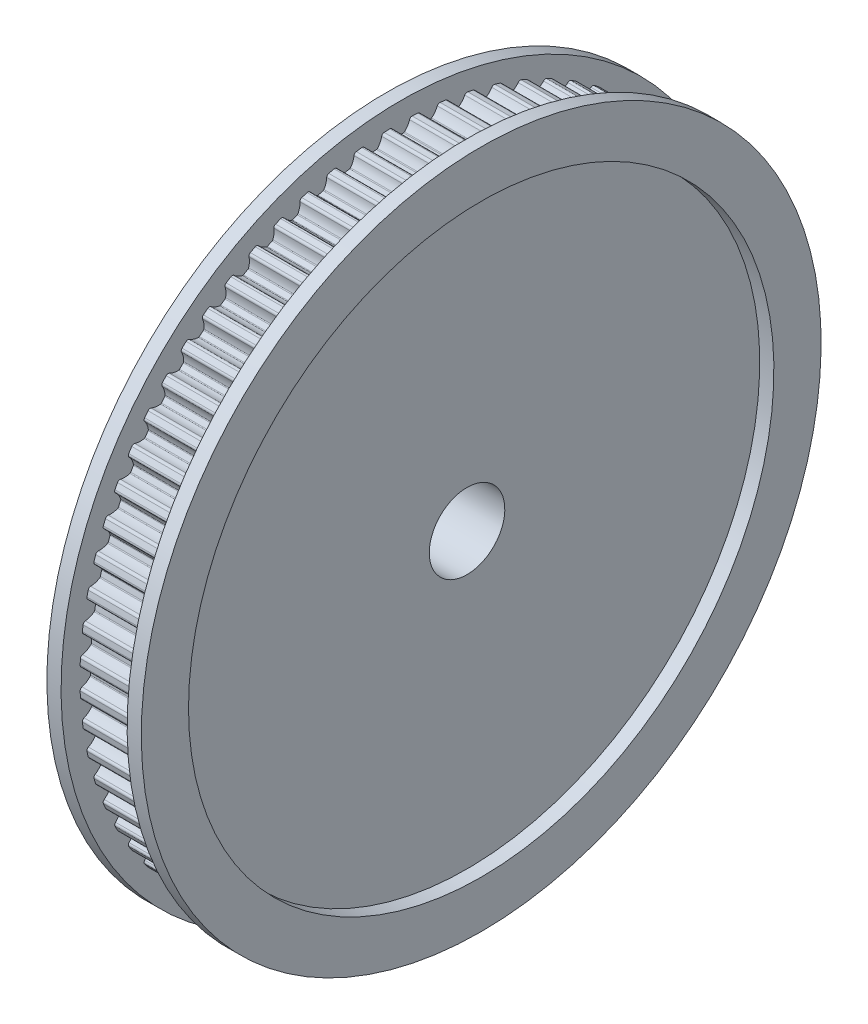
from build123d import *

# Parameters (mm, degrees)
HOLE_WIZARD_1_D          = 8
SKETCH_4_R               = 38.995
CUT_EXTRUDE_1_DEPTH      = 7
CUT_EXTRUDE_2_DEPTH      = 54.469617541
CUT_EXTRUDE_2_DEPTH_BACK = 54.469617541
SKETCH_6_W               = 17.213021686
SKETCH_6_H               = 104.733980807
SKETCH_6_W_2             = 36.314797365
SKETCH_6_H_2             = 107.365487863
SKETCH_9_R               = 36
SKETCH_9_R_2             = 31
EXTRUDE_1_DEPTH          = 1.5
MOVE_FACE_1_BY           = 2
MOVE_FACE_1_2_BY         = 2
MOVE_FACE_1_3_BY         = 2


with BuildPart() as part:
    # 草图1 → 旋转1 (revolve)
    with BuildSketch(Plane.XY):
        Polygon((0, 0), (0, 29), (1, 29), (1, 33.863347502), (0.22888685, 36.741180955), (1.194812677, 37), (2, 33.995), (9, 33.995), (9.805187323, 37), (10.77111315, 36.741180955), (10, 33.863347502), (10, 29), (11, 29), (11, 0), align=None)
    revolve(axis=Axis((11, 0, 0), (-1, 0, 0)))

    # 孔1 (through all)
    with Locations(Plane(origin=(11, 0, 0), x_dir=(0, 0, -1), z_dir=(1, 0, 0))):
        with Locations((0, 0)):
            Hole(HOLE_WIZARD_1_D / 2)

    # 草图4 → 切除-拉伸1 (cut)
    with BuildSketch(Plane(origin=(2, 0, 0), x_dir=(0, 0, -1), z_dir=(1, 0, 0))):
        Circle(SKETCH_4_R)
        with BuildLine():
            ThreePointArc((-33.777168623, -0.911681599), (-33.922614408, -1.016968994), (-33.974202198, -1.18895333))
            ThreePointArc((-33.974202198, -1.18895333), (-33.962644293, -1.482841073), (-33.948544212, -1.776617823))
            ThreePointArc((-33.948544212, -1.776617823), (-33.882163306, -1.943451535), (-33.728094586, -2.035661844))
            ThreePointArc((-33.728094586, -2.035661844), (-33.250950915, -2.205234617), (-32.832609462, -2.490561511))
            ThreePointArc((-32.832609462, -2.490561511), (-32.79799474, -2.535862185), (-32.782784237, -2.590807344))
            ThreePointArc((-32.782784237, -2.590807344), (-32.759862647, -2.8661166), (-32.734629056, -3.141223582))
            ThreePointArc((-32.734629056, -3.141223582), (-32.740067351, -3.197975278), (-32.766289818, -3.248598516))
            ThreePointArc((-32.766289818, -3.248598516), (-33.128729229, -3.602234884), (-33.569178012, -3.852086595))
            ThreePointArc((-33.569178012, -3.852086595), (-33.70489393, -3.969649775), (-33.741295991, -4.14547583))
            ThreePointArc((-33.741295991, -4.14547583), (-33.704168062, -4.437237905), (-33.664517306, -4.728667842))
            ThreePointArc((-33.664517306, -4.728667842), (-33.583848484, -4.889081224), (-33.422329383, -4.967512671))
            ThreePointArc((-33.422329383, -4.967512671), (-32.932222147, -5.094854357), (-32.490604733, -5.342634636))
            ThreePointArc((-32.490604733, -5.342634636), (-32.452173516, -5.384746056), (-32.432232107, -5.43815645))
            ThreePointArc((-32.432232107, -5.43815645), (-32.385402958, -5.710420323), (-32.336288235, -5.982281187))
            ThreePointArc((-32.336288235, -5.982281187), (-32.336759599, -6.039290904), (-32.358470176, -6.092006944))
            ThreePointArc((-32.358470176, -6.092006944), (-32.688708956, -6.475886295), (-33.105705687, -6.763174885))
            ThreePointArc((-33.105705687, -6.763174885), (-33.230658859, -6.892119123), (-33.251598148, -7.070448756))
            ThreePointArc((-33.251598148, -7.070448756), (-33.189182762, -7.357864676), (-33.124283096, -7.644729844))
            ThreePointArc((-33.124283096, -7.644729844), (-33.029940296, -7.797502053), (-32.862200073, -7.861557728))
            ThreePointArc((-32.862200073, -7.861557728), (-32.362859284, -7.94569918), (-31.901326883, -8.154047086))
            ThreePointArc((-31.901326883, -8.154047086), (-31.859371657, -8.192648758), (-31.834851107, -8.244117901))
            ThreePointArc((-31.834851107, -8.244117901), (-31.764470798, -8.511264298), (-31.691848735, -8.77781002))
            ThreePointArc((-31.691848735, -8.77781002), (-31.687349582, -8.83464388), (-31.704383038, -8.889051521))
            ThreePointArc((-31.704383038, -8.889051521), (-31.999907869, -9.300252301), (-32.390278951, -9.622791331))
            ThreePointArc((-32.390278951, -9.622791331), (-32.503518408, -9.762135284), (-32.508835565, -9.941611298))
            ThreePointArc((-32.508835565, -9.941611298), (-32.421607741, -10.222493654), (-32.331953091, -10.502610835))
            ThreePointArc((-32.331953091, -10.502610835), (-32.224654318, -10.646579182), (-32.051969577, -10.695771583))
            ThreePointArc((-32.051969577, -10.695771583), (-31.54719552, -10.736072434), (-31.069260672, -10.903402314))
            ThreePointArc((-31.069260672, -10.903402314), (-31.024100741, -10.938200456), (-30.995187669, -10.987336637))
            ThreePointArc((-30.995187669, -10.987336637), (-30.901791835, -11.247332413), (-30.806215131, -11.506534418))
            ThreePointArc((-30.806215131, -11.506534418), (-30.796779701, -11.562759881), (-30.809006401, -11.618445048))
            ThreePointArc((-30.809006401, -11.618445048), (-31.067568161, -12.053837772), (-31.428342635, -12.409172525))
            ThreePointArc((-31.428342635, -12.409172525), (-31.529006556, -12.557855701), (-31.518661114, -12.737112175))
            ThreePointArc((-31.518661114, -12.737112175), (-31.407284708, -13.009323283), (-31.2935574, -13.280560616))
            ThreePointArc((-31.2935574, -13.280560616), (-31.174119263, -13.414629416), (-30.99780424, -13.448584158))
            ThreePointArc((-30.99780424, -13.448584158), (-30.49143855, -13.444737694), (-30.000738628, -13.569776067))
            ThreePointArc((-30.000738628, -13.569776067), (-29.952717686, -13.600505844), (-29.919632137, -13.646935107))
            ThreePointArc((-29.919632137, -13.646935107), (-29.803931577, -13.897801537), (-29.686127628, -14.147687142))
            ThreePointArc((-29.686127628, -14.147687142), (-29.671827731, -14.202876298), (-29.679154622, -14.259415193))
            ThreePointArc((-29.679154622, -14.259415193), (-29.898785501, -14.715686258), (-30.227217655, -15.101112423))
            ThreePointArc((-30.227217655, -15.101112423), (-30.314539926, -15.258003253), (-30.288610621, -15.435675938))
            ThreePointArc((-30.288610621, -15.435675938), (-30.153933274, -15.697144107), (-30.016998841, -15.957437311))
            ThreePointArc((-30.016998841, -15.957437311), (-29.886330337, -16.08058622), (-29.707726895, -16.099044887))
            ThreePointArc((-29.707726895, -16.099044887), (-29.20362332, -16.051080383), (-28.703892848, -16.132875631))
            ThreePointArc((-28.703892848, -16.132875631), (-28.653376364, -16.15930317), (-28.616370138, -16.20267216))
            ThreePointArc((-28.616370138, -16.20267216), (-28.479245403, -16.4425), (-28.340110769, -16.681167424))
            ThreePointArc((-28.340110769, -16.681167424), (-28.321055235, -16.73490025), (-28.323426556, -16.791862579))
            ThreePointArc((-28.323426556, -16.791862579), (-28.50245503, -17.265539487), (-28.796045296, -17.678123736))
            ThreePointArc((-28.796045296, -17.678123736), (-28.869361343, -17.842028188), (-28.828045512, -18.016764886))
            ThreePointArc((-28.828045512, -18.016764886), (-28.6710922, -18.265500186), (-28.511992797, -18.512868274))
            ThreePointArc((-28.511992797, -18.512868274), (-28.371088391, -18.624160053), (-28.191555811, -18.626982163))
            ThreePointArc((-28.191555811, -18.626982163), (-27.693550884, -18.535264657), (-27.188593112, -18.573194269))
            ThreePointArc((-27.188593112, -18.573194269), (-27.135965546, -18.595118443), (-27.095320283, -18.635097095))
            ThreePointArc((-27.095320283, -18.635097095), (-26.937814976, -18.862061109), (-26.778408555, -19.087693949))
            ThreePointArc((-26.778408555, -19.087693949), (-26.754742408, -19.139561507), (-26.752140112, -19.196513751))
            ThreePointArc((-26.752140112, -19.196513751), (-26.889203665, -19.683991535), (-27.145717645, -20.120593854))
            ThreePointArc((-27.145717645, -20.120593854), (-27.204469488, -20.290264514), (-27.14808157, -20.460735375))
            ThreePointArc((-27.14808157, -20.460735375), (-26.970046803, -20.694844779), (-26.789993272, -20.92740513))
            ThreePointArc((-26.789993272, -20.92740513), (-26.639925332, -21.025992783), (-26.460829964, -21.013156858))
            ThreePointArc((-26.460829964, -21.013156858), (-25.972713804, -20.878384376), (-25.466371765, -20.872159684))
            ThreePointArc((-25.466371765, -20.872159684), (-25.412033645, -20.889413635), (-25.368058681, -20.925697689))
            ThreePointArc((-25.368058681, -20.925697689), (-25.191371512, -21.138070545), (-25.012906482, -21.348951598))
            ThreePointArc((-25.012906482, -21.348951598), (-24.984809837, -21.398559144), (-24.977253728, -21.455067862))
            ThreePointArc((-24.977253728, -21.455067862), (-25.071309225, -21.952636522), (-25.288794692, -22.409934104))
            ThreePointArc((-25.288794692, -22.409934104), (-25.332535194, -22.584079676), (-25.261504334, -22.748987313))
            ThreePointArc((-25.261504334, -22.748987313), (-25.063743065, -22.966689108), (-24.864105721, -23.182671798))
            ThreePointArc((-24.864105721, -23.182671798), (-24.706016355, -23.267805011), (-24.528721224, -23.239408742))
            ThreePointArc((-24.528721224, -23.239408742), (-24.054208689, -23.062606983), (-23.550335952, -23.012275362))
            ThreePointArc((-23.550335952, -23.012275362), (-23.494700824, -23.024727777), (-23.447730834, -23.057041088))
            ThreePointArc((-23.447730834, -23.057041088), (-23.253206499, -23.253206499), (-23.057041088, -23.447730834))
            ThreePointArc((-23.057041088, -23.447730834), (-23.024727777, -23.494700824), (-23.012275362, -23.550335952))
            ThreePointArc((-23.012275362, -23.550335952), (-23.062606983, -24.054208689), (-23.239408742, -24.528721224))
            ThreePointArc((-23.239408742, -24.528721224), (-23.267805011, -24.706016355), (-23.182671798, -24.864105721))
            ThreePointArc((-23.182671798, -24.864105721), (-22.966689108, -25.063743065), (-22.748987313, -25.261504334))
            ThreePointArc((-22.748987313, -25.261504334), (-22.584079676, -25.332535194), (-22.409934104, -25.288794692))
            ThreePointArc((-22.409934104, -25.288794692), (-21.952636522, -25.071309225), (-21.455067862, -24.977253728))
            ThreePointArc((-21.455067862, -24.977253728), (-21.398559144, -24.984809837), (-21.348951598, -25.012906482))
            ThreePointArc((-21.348951598, -25.012906482), (-21.138070545, -25.191371512), (-20.925697689, -25.368058681))
            ThreePointArc((-20.925697689, -25.368058681), (-20.889413635, -25.412033645), (-20.872159684, -25.466371765))
            ThreePointArc((-20.872159684, -25.466371765), (-20.878384376, -25.972713804), (-21.013156858, -26.460829964))
            ThreePointArc((-21.013156858, -26.460829964), (-21.025992783, -26.639925332), (-20.92740513, -26.789993272))
            ThreePointArc((-20.92740513, -26.789993272), (-20.694844779, -26.970046803), (-20.460735375, -27.14808157))
            ThreePointArc((-20.460735375, -27.14808157), (-20.290264514, -27.204469488), (-20.120593854, -27.145717645))
            ThreePointArc((-20.120593854, -27.145717645), (-19.683991535, -26.889203665), (-19.196513751, -26.752140112))
            ThreePointArc((-19.196513751, -26.752140112), (-19.139561507, -26.754742408), (-19.087693949, -26.778408555))
            ThreePointArc((-19.087693949, -26.778408555), (-18.862061109, -26.937814976), (-18.635097095, -27.095320283))
            ThreePointArc((-18.635097095, -27.095320283), (-18.595118443, -27.135965546), (-18.573194269, -27.188593112))
            ThreePointArc((-18.573194269, -27.188593112), (-18.535264657, -27.693550884), (-18.626982163, -28.191555811))
            ThreePointArc((-18.626982163, -28.191555811), (-18.624160053, -28.371088391), (-18.512868274, -28.511992797))
            ThreePointArc((-18.512868274, -28.511992797), (-18.265500186, -28.6710922), (-18.016764886, -28.828045512))
            ThreePointArc((-18.016764886, -28.828045512), (-17.842028188, -28.869361343), (-17.678123736, -28.796045296))
            ThreePointArc((-17.678123736, -28.796045296), (-17.265539487, -28.50245503), (-16.791862579, -28.323426556))
            ThreePointArc((-16.791862579, -28.323426556), (-16.73490025, -28.321055235), (-16.681167424, -28.340110769))
            ThreePointArc((-16.681167424, -28.340110769), (-16.4425, -28.479245403), (-16.20267216, -28.616370138))
            ThreePointArc((-16.20267216, -28.616370138), (-16.15930317, -28.653376364), (-16.132875631, -28.703892848))
            ThreePointArc((-16.132875631, -28.703892848), (-16.051080383, -29.20362332), (-16.099044887, -29.707726895))
            ThreePointArc((-16.099044887, -29.707726895), (-16.08058622, -29.886330337), (-15.957437311, -30.016998841))
            ThreePointArc((-15.957437311, -30.016998841), (-15.697144107, -30.153933274), (-15.435675938, -30.288610621))
            ThreePointArc((-15.435675938, -30.288610621), (-15.258003253, -30.314539926), (-15.101112423, -30.227217655))
            ThreePointArc((-15.101112423, -30.227217655), (-14.715686258, -29.898785501), (-14.259415193, -29.679154622))
            ThreePointArc((-14.259415193, -29.679154622), (-14.202876298, -29.671827731), (-14.147687142, -29.686127628))
            ThreePointArc((-14.147687142, -29.686127628), (-13.897801537, -29.803931577), (-13.646935107, -29.919632137))
            ThreePointArc((-13.646935107, -29.919632137), (-13.600505844, -29.952717686), (-13.569776067, -30.000738628))
            ThreePointArc((-13.569776067, -30.000738628), (-13.444737694, -30.49143855), (-13.448584158, -30.99780424))
            ThreePointArc((-13.448584158, -30.99780424), (-13.414629416, -31.174119263), (-13.280560616, -31.2935574))
            ThreePointArc((-13.280560616, -31.2935574), (-13.009323283, -31.407284708), (-12.737112175, -31.518661114))
            ThreePointArc((-12.737112175, -31.518661114), (-12.557855701, -31.529006556), (-12.409172525, -31.428342635))
            ThreePointArc((-12.409172525, -31.428342635), (-12.053837772, -31.067568161), (-11.618445048, -30.809006401))
            ThreePointArc((-11.618445048, -30.809006401), (-11.562759881, -30.796779701), (-11.506534418, -30.806215131))
            ThreePointArc((-11.506534418, -30.806215131), (-11.247332413, -30.901791835), (-10.987336637, -30.995187669))
            ThreePointArc((-10.987336637, -30.995187669), (-10.938200456, -31.024100741), (-10.903402314, -31.069260672))
            ThreePointArc((-10.903402314, -31.069260672), (-10.736072434, -31.54719552), (-10.695771583, -32.051969577))
            ThreePointArc((-10.695771583, -32.051969577), (-10.646579182, -32.224654318), (-10.502610835, -32.331953091))
            ThreePointArc((-10.502610835, -32.331953091), (-10.222493654, -32.421607741), (-9.941611298, -32.508835565))
            ThreePointArc((-9.941611298, -32.508835565), (-9.762135284, -32.503518408), (-9.622791331, -32.390278951))
            ThreePointArc((-9.622791331, -32.390278951), (-9.300252301, -31.999907869), (-8.889051521, -31.704383038))
            ThreePointArc((-8.889051521, -31.704383038), (-8.83464388, -31.687349582), (-8.77781002, -31.691848735))
            ThreePointArc((-8.77781002, -31.691848735), (-8.511264298, -31.764470798), (-8.244117901, -31.834851107))
            ThreePointArc((-8.244117901, -31.834851107), (-8.192648758, -31.859371657), (-8.154047086, -31.901326883))
            ThreePointArc((-8.154047086, -31.901326883), (-7.94569918, -32.362859284), (-7.861557728, -32.862200073))
            ThreePointArc((-7.861557728, -32.862200073), (-7.797502053, -33.029940296), (-7.644729844, -33.124283096))
            ThreePointArc((-7.644729844, -33.124283096), (-7.357864676, -33.189182762), (-7.070448756, -33.251598148))
            ThreePointArc((-7.070448756, -33.251598148), (-6.892119123, -33.230658859), (-6.763174885, -33.105705687))
            ThreePointArc((-6.763174885, -33.105705687), (-6.475886295, -32.688708956), (-6.092006944, -32.358470176))
            ThreePointArc((-6.092006944, -32.358470176), (-6.039290904, -32.336759599), (-5.982281187, -32.336288235))
            ThreePointArc((-5.982281187, -32.336288235), (-5.710420323, -32.385402958), (-5.43815645, -32.432232107))
            ThreePointArc((-5.43815645, -32.432232107), (-5.384746056, -32.452173516), (-5.342634636, -32.490604733))
            ThreePointArc((-5.342634636, -32.490604733), (-5.094854357, -32.932222147), (-4.967512671, -33.422329383))
            ThreePointArc((-4.967512671, -33.422329383), (-4.889081224, -33.583848484), (-4.728667842, -33.664517306))
            ThreePointArc((-4.728667842, -33.664517306), (-4.437237905, -33.704168062), (-4.14547583, -33.741295991))
            ThreePointArc((-4.14547583, -33.741295991), (-3.969649775, -33.70489393), (-3.852086595, -33.569178012))
            ThreePointArc((-3.852086595, -33.569178012), (-3.602234884, -33.128729229), (-3.248598516, -32.766289818))
            ThreePointArc((-3.248598516, -32.766289818), (-3.197975278, -32.740067351), (-3.141223582, -32.734629056))
            ThreePointArc((-3.141223582, -32.734629056), (-2.8661166, -32.759862647), (-2.590807344, -32.782784237))
            ThreePointArc((-2.590807344, -32.782784237), (-2.535862185, -32.79799474), (-2.490561511, -32.832609462))
            ThreePointArc((-2.490561511, -32.832609462), (-2.205234617, -33.250950915), (-2.035661844, -33.728094586))
            ThreePointArc((-2.035661844, -33.728094586), (-1.943451535, -33.882163306), (-1.776617823, -33.948544212))
            ThreePointArc((-1.776617823, -33.948544212), (-1.482841073, -33.962644293), (-1.18895333, -33.974202198))
            ThreePointArc((-1.18895333, -33.974202198), (-1.016968994, -33.922614408), (-0.911681599, -33.777168623))
            ThreePointArc((-0.911681599, -33.777168623), (-0.701168291, -33.316619869), (-0.380466292, -32.924738209))
            ThreePointArc((-0.380466292, -32.924738209), (-0.332321129, -32.894203421), (-0.276259369, -32.883839584))
            ThreePointArc((-0.276259369, -32.883839584), (0, -32.885), (0.276259369, -32.883839584))
            ThreePointArc((0.276259369, -32.883839584), (0.332321129, -32.894203421), (0.380466292, -32.924738209))
            ThreePointArc((0.380466292, -32.924738209), (0.701168291, -33.316619869), (0.911681599, -33.777168623))
            ThreePointArc((0.911681599, -33.777168623), (1.016968994, -33.922614408), (1.18895333, -33.974202198))
            ThreePointArc((1.18895333, -33.974202198), (1.482841073, -33.962644293), (1.776617823, -33.948544212))
            ThreePointArc((1.776617823, -33.948544212), (1.943451535, -33.882163306), (2.035661844, -33.728094586))
            ThreePointArc((2.035661844, -33.728094586), (2.205234617, -33.250950915), (2.490561511, -32.832609462))
            ThreePointArc((2.490561511, -32.832609462), (2.535862185, -32.79799474), (2.590807344, -32.782784237))
            ThreePointArc((2.590807344, -32.782784237), (2.8661166, -32.759862647), (3.141223582, -32.734629056))
            ThreePointArc((3.141223582, -32.734629056), (3.197975278, -32.740067351), (3.248598516, -32.766289818))
            ThreePointArc((3.248598516, -32.766289818), (3.602234884, -33.128729229), (3.852086595, -33.569178012))
            ThreePointArc((3.852086595, -33.569178012), (3.969649775, -33.70489393), (4.14547583, -33.741295991))
            ThreePointArc((4.14547583, -33.741295991), (4.437237905, -33.704168062), (4.728667842, -33.664517306))
            ThreePointArc((4.728667842, -33.664517306), (4.889081224, -33.583848484), (4.967512671, -33.422329383))
            ThreePointArc((4.967512671, -33.422329383), (5.094854357, -32.932222147), (5.342634636, -32.490604733))
            ThreePointArc((5.342634636, -32.490604733), (5.384746056, -32.452173516), (5.43815645, -32.432232107))
            ThreePointArc((5.43815645, -32.432232107), (5.710420323, -32.385402958), (5.982281187, -32.336288235))
            ThreePointArc((5.982281187, -32.336288235), (6.039290904, -32.336759599), (6.092006944, -32.358470176))
            ThreePointArc((6.092006944, -32.358470176), (6.475886295, -32.688708956), (6.763174885, -33.105705687))
            ThreePointArc((6.763174885, -33.105705687), (6.892119123, -33.230658859), (7.070448756, -33.251598148))
            ThreePointArc((7.070448756, -33.251598148), (7.357864676, -33.189182762), (7.644729844, -33.124283096))
            ThreePointArc((7.644729844, -33.124283096), (7.797502053, -33.029940296), (7.861557728, -32.862200073))
            ThreePointArc((7.861557728, -32.862200073), (7.94569918, -32.362859284), (8.154047086, -31.901326883))
            ThreePointArc((8.154047086, -31.901326883), (8.192648758, -31.859371657), (8.244117901, -31.834851107))
            ThreePointArc((8.244117901, -31.834851107), (8.511264298, -31.764470798), (8.77781002, -31.691848735))
            ThreePointArc((8.77781002, -31.691848735), (8.83464388, -31.687349582), (8.889051521, -31.704383038))
            ThreePointArc((8.889051521, -31.704383038), (9.300252301, -31.999907869), (9.622791331, -32.390278951))
            ThreePointArc((9.622791331, -32.390278951), (9.762135284, -32.503518408), (9.941611298, -32.508835565))
            ThreePointArc((9.941611298, -32.508835565), (10.222493654, -32.421607741), (10.502610835, -32.331953091))
            ThreePointArc((10.502610835, -32.331953091), (10.646579182, -32.224654318), (10.695771583, -32.051969577))
            ThreePointArc((10.695771583, -32.051969577), (10.736072434, -31.54719552), (10.903402314, -31.069260672))
            ThreePointArc((10.903402314, -31.069260672), (10.938200456, -31.024100741), (10.987336637, -30.995187669))
            ThreePointArc((10.987336637, -30.995187669), (11.247332413, -30.901791835), (11.506534418, -30.806215131))
            ThreePointArc((11.506534418, -30.806215131), (11.562759881, -30.796779701), (11.618445048, -30.809006401))
            ThreePointArc((11.618445048, -30.809006401), (12.053837772, -31.067568161), (12.409172525, -31.428342635))
            ThreePointArc((12.409172525, -31.428342635), (12.557855701, -31.529006556), (12.737112175, -31.518661114))
            ThreePointArc((12.737112175, -31.518661114), (13.009323283, -31.407284708), (13.280560616, -31.2935574))
            ThreePointArc((13.280560616, -31.2935574), (13.414629416, -31.174119263), (13.448584158, -30.99780424))
            ThreePointArc((13.448584158, -30.99780424), (13.444737694, -30.49143855), (13.569776067, -30.000738628))
            ThreePointArc((13.569776067, -30.000738628), (13.600505844, -29.952717686), (13.646935107, -29.919632137))
            ThreePointArc((13.646935107, -29.919632137), (13.897801537, -29.803931577), (14.147687142, -29.686127628))
            ThreePointArc((14.147687142, -29.686127628), (14.202876298, -29.671827731), (14.259415193, -29.679154622))
            ThreePointArc((14.259415193, -29.679154622), (14.715686258, -29.898785501), (15.101112423, -30.227217655))
            ThreePointArc((15.101112423, -30.227217655), (15.258003253, -30.314539926), (15.435675938, -30.288610621))
            ThreePointArc((15.435675938, -30.288610621), (15.697144107, -30.153933274), (15.957437311, -30.016998841))
            ThreePointArc((15.957437311, -30.016998841), (16.08058622, -29.886330337), (16.099044887, -29.707726895))
            ThreePointArc((16.099044887, -29.707726895), (16.051080383, -29.20362332), (16.132875631, -28.703892848))
            ThreePointArc((16.132875631, -28.703892848), (16.15930317, -28.653376364), (16.20267216, -28.616370138))
            ThreePointArc((16.20267216, -28.616370138), (16.4425, -28.479245403), (16.681167424, -28.340110769))
            ThreePointArc((16.681167424, -28.340110769), (16.73490025, -28.321055235), (16.791862579, -28.323426556))
            ThreePointArc((16.791862579, -28.323426556), (17.265539487, -28.50245503), (17.678123736, -28.796045296))
            ThreePointArc((17.678123736, -28.796045296), (17.842028188, -28.869361343), (18.016764886, -28.828045512))
            ThreePointArc((18.016764886, -28.828045512), (18.265500186, -28.6710922), (18.512868274, -28.511992797))
            ThreePointArc((18.512868274, -28.511992797), (18.624160053, -28.371088391), (18.626982163, -28.191555811))
            ThreePointArc((18.626982163, -28.191555811), (18.535264657, -27.693550884), (18.573194269, -27.188593112))
            ThreePointArc((18.573194269, -27.188593112), (18.595118443, -27.135965546), (18.635097095, -27.095320283))
            ThreePointArc((18.635097095, -27.095320283), (18.862061109, -26.937814976), (19.087693949, -26.778408555))
            ThreePointArc((19.087693949, -26.778408555), (19.139561507, -26.754742408), (19.196513751, -26.752140112))
            ThreePointArc((19.196513751, -26.752140112), (19.683991535, -26.889203665), (20.120593854, -27.145717645))
            ThreePointArc((20.120593854, -27.145717645), (20.290264514, -27.204469488), (20.460735375, -27.14808157))
            ThreePointArc((20.460735375, -27.14808157), (20.694844779, -26.970046803), (20.92740513, -26.789993272))
            ThreePointArc((20.92740513, -26.789993272), (21.025992783, -26.639925332), (21.013156858, -26.460829964))
            ThreePointArc((21.013156858, -26.460829964), (20.878384376, -25.972713804), (20.872159684, -25.466371765))
            ThreePointArc((20.872159684, -25.466371765), (20.889413635, -25.412033645), (20.925697689, -25.368058681))
            ThreePointArc((20.925697689, -25.368058681), (21.138070545, -25.191371512), (21.348951598, -25.012906482))
            ThreePointArc((21.348951598, -25.012906482), (21.398559144, -24.984809837), (21.455067862, -24.977253728))
            ThreePointArc((21.455067862, -24.977253728), (21.952636522, -25.071309225), (22.409934104, -25.288794692))
            ThreePointArc((22.409934104, -25.288794692), (22.584079676, -25.332535194), (22.748987313, -25.261504334))
            ThreePointArc((22.748987313, -25.261504334), (22.966689108, -25.063743065), (23.182671798, -24.864105721))
            ThreePointArc((23.182671798, -24.864105721), (23.267805011, -24.706016355), (23.239408742, -24.528721224))
            ThreePointArc((23.239408742, -24.528721224), (23.062606983, -24.054208689), (23.012275362, -23.550335952))
            ThreePointArc((23.012275362, -23.550335952), (23.024727777, -23.494700824), (23.057041088, -23.447730834))
            ThreePointArc((23.057041088, -23.447730834), (23.253206499, -23.253206499), (23.447730834, -23.057041088))
            ThreePointArc((23.447730834, -23.057041088), (23.494700824, -23.024727777), (23.550335952, -23.012275362))
            ThreePointArc((23.550335952, -23.012275362), (24.054208689, -23.062606983), (24.528721224, -23.239408742))
            ThreePointArc((24.528721224, -23.239408742), (24.706016355, -23.267805011), (24.864105721, -23.182671798))
            ThreePointArc((24.864105721, -23.182671798), (25.063743065, -22.966689108), (25.261504334, -22.748987313))
            ThreePointArc((25.261504334, -22.748987313), (25.332535194, -22.584079676), (25.288794692, -22.409934104))
            ThreePointArc((25.288794692, -22.409934104), (25.071309225, -21.952636522), (24.977253728, -21.455067862))
            ThreePointArc((24.977253728, -21.455067862), (24.984809837, -21.398559144), (25.012906482, -21.348951598))
            ThreePointArc((25.012906482, -21.348951598), (25.191371512, -21.138070545), (25.368058681, -20.925697689))
            ThreePointArc((25.368058681, -20.925697689), (25.412033645, -20.889413635), (25.466371765, -20.872159684))
            ThreePointArc((25.466371765, -20.872159684), (25.972713804, -20.878384376), (26.460829964, -21.013156858))
            ThreePointArc((26.460829964, -21.013156858), (26.639925332, -21.025992783), (26.789993272, -20.92740513))
            ThreePointArc((26.789993272, -20.92740513), (26.970046803, -20.694844779), (27.14808157, -20.460735375))
            ThreePointArc((27.14808157, -20.460735375), (27.204469488, -20.290264514), (27.145717645, -20.120593854))
            ThreePointArc((27.145717645, -20.120593854), (26.889203665, -19.683991535), (26.752140112, -19.196513751))
            ThreePointArc((26.752140112, -19.196513751), (26.754742408, -19.139561507), (26.778408555, -19.087693949))
            ThreePointArc((26.778408555, -19.087693949), (26.937814976, -18.862061109), (27.095320283, -18.635097095))
            ThreePointArc((27.095320283, -18.635097095), (27.135965546, -18.595118443), (27.188593112, -18.573194269))
            ThreePointArc((27.188593112, -18.573194269), (27.693550884, -18.535264657), (28.191555811, -18.626982163))
            ThreePointArc((28.191555811, -18.626982163), (28.371088391, -18.624160053), (28.511992797, -18.512868274))
            ThreePointArc((28.511992797, -18.512868274), (28.6710922, -18.265500186), (28.828045512, -18.016764886))
            ThreePointArc((28.828045512, -18.016764886), (28.869361343, -17.842028188), (28.796045296, -17.678123736))
            ThreePointArc((28.796045296, -17.678123736), (28.50245503, -17.265539487), (28.323426556, -16.791862579))
            ThreePointArc((28.323426556, -16.791862579), (28.321055235, -16.73490025), (28.340110769, -16.681167424))
            ThreePointArc((28.340110769, -16.681167424), (28.479245403, -16.4425), (28.616370138, -16.20267216))
            ThreePointArc((28.616370138, -16.20267216), (28.653376364, -16.15930317), (28.703892848, -16.132875631))
            ThreePointArc((28.703892848, -16.132875631), (29.20362332, -16.051080383), (29.707726895, -16.099044887))
            ThreePointArc((29.707726895, -16.099044887), (29.886330337, -16.08058622), (30.016998841, -15.957437311))
            ThreePointArc((30.016998841, -15.957437311), (30.153933274, -15.697144107), (30.288610621, -15.435675938))
            ThreePointArc((30.288610621, -15.435675938), (30.314539926, -15.258003253), (30.227217655, -15.101112423))
            ThreePointArc((30.227217655, -15.101112423), (29.898785501, -14.715686258), (29.679154622, -14.259415193))
            ThreePointArc((29.679154622, -14.259415193), (29.671827731, -14.202876298), (29.686127628, -14.147687142))
            ThreePointArc((29.686127628, -14.147687142), (29.803931577, -13.897801537), (29.919632137, -13.646935107))
            ThreePointArc((29.919632137, -13.646935107), (29.952717686, -13.600505844), (30.000738628, -13.569776067))
            ThreePointArc((30.000738628, -13.569776067), (30.49143855, -13.444737694), (30.99780424, -13.448584158))
            ThreePointArc((30.99780424, -13.448584158), (31.174119263, -13.414629416), (31.2935574, -13.280560616))
            ThreePointArc((31.2935574, -13.280560616), (31.407284708, -13.009323283), (31.518661114, -12.737112175))
            ThreePointArc((31.518661114, -12.737112175), (31.529006556, -12.557855701), (31.428342635, -12.409172525))
            ThreePointArc((31.428342635, -12.409172525), (31.067568161, -12.053837772), (30.809006401, -11.618445048))
            ThreePointArc((30.809006401, -11.618445048), (30.796779701, -11.562759881), (30.806215131, -11.506534418))
            ThreePointArc((30.806215131, -11.506534418), (30.901791835, -11.247332413), (30.995187669, -10.987336637))
            ThreePointArc((30.995187669, -10.987336637), (31.024100741, -10.938200456), (31.069260672, -10.903402314))
            ThreePointArc((31.069260672, -10.903402314), (31.54719552, -10.736072434), (32.051969577, -10.695771583))
            ThreePointArc((32.051969577, -10.695771583), (32.224654318, -10.646579182), (32.331953091, -10.502610835))
            ThreePointArc((32.331953091, -10.502610835), (32.421607741, -10.222493654), (32.508835565, -9.941611298))
            ThreePointArc((32.508835565, -9.941611298), (32.503518408, -9.762135284), (32.390278951, -9.622791331))
            ThreePointArc((32.390278951, -9.622791331), (31.999907869, -9.300252301), (31.704383038, -8.889051521))
            ThreePointArc((31.704383038, -8.889051521), (31.687349582, -8.83464388), (31.691848735, -8.77781002))
            ThreePointArc((31.691848735, -8.77781002), (31.764470798, -8.511264298), (31.834851107, -8.244117901))
            ThreePointArc((31.834851107, -8.244117901), (31.859371657, -8.192648758), (31.901326883, -8.154047086))
            ThreePointArc((31.901326883, -8.154047086), (32.362859284, -7.94569918), (32.862200073, -7.861557728))
            ThreePointArc((32.862200073, -7.861557728), (33.029940296, -7.797502053), (33.124283096, -7.644729844))
            ThreePointArc((33.124283096, -7.644729844), (33.189182762, -7.357864676), (33.251598148, -7.070448756))
            ThreePointArc((33.251598148, -7.070448756), (33.230658859, -6.892119123), (33.105705687, -6.763174885))
            ThreePointArc((33.105705687, -6.763174885), (32.688708956, -6.475886295), (32.358470176, -6.092006944))
            ThreePointArc((32.358470176, -6.092006944), (32.336759599, -6.039290904), (32.336288235, -5.982281187))
            ThreePointArc((32.336288235, -5.982281187), (32.385402958, -5.710420323), (32.432232107, -5.43815645))
            ThreePointArc((32.432232107, -5.43815645), (32.452173516, -5.384746056), (32.490604733, -5.342634636))
            ThreePointArc((32.490604733, -5.342634636), (32.932222147, -5.094854357), (33.422329383, -4.967512671))
            ThreePointArc((33.422329383, -4.967512671), (33.583848484, -4.889081224), (33.664517306, -4.728667842))
            ThreePointArc((33.664517306, -4.728667842), (33.704168062, -4.437237905), (33.741295991, -4.14547583))
            ThreePointArc((33.741295991, -4.14547583), (33.70489393, -3.969649775), (33.569178012, -3.852086595))
            ThreePointArc((33.569178012, -3.852086595), (33.128729229, -3.602234884), (32.766289818, -3.248598516))
            ThreePointArc((32.766289818, -3.248598516), (32.740067351, -3.197975278), (32.734629056, -3.141223582))
            ThreePointArc((32.734629056, -3.141223582), (32.759862647, -2.8661166), (32.782784237, -2.590807344))
            ThreePointArc((32.782784237, -2.590807344), (32.79799474, -2.535862185), (32.832609462, -2.490561511))
            ThreePointArc((32.832609462, -2.490561511), (33.250950915, -2.205234617), (33.728094586, -2.035661844))
            ThreePointArc((33.728094586, -2.035661844), (33.882163306, -1.943451535), (33.948544212, -1.776617823))
            ThreePointArc((33.948544212, -1.776617823), (33.962644293, -1.482841073), (33.974202198, -1.18895333))
            ThreePointArc((33.974202198, -1.18895333), (33.922614408, -1.016968994), (33.777168623, -0.911681599))
            ThreePointArc((33.777168623, -0.911681599), (33.316619869, -0.701168291), (32.924738209, -0.380466292))
            ThreePointArc((32.924738209, -0.380466292), (32.894203421, -0.332321129), (32.883839584, -0.276259369))
            ThreePointArc((32.883839584, -0.276259369), (32.885, 0), (32.883839584, 0.276259369))
            ThreePointArc((32.883839584, 0.276259369), (32.894203421, 0.332321129), (32.924738209, 0.380466292))
            ThreePointArc((32.924738209, 0.380466292), (33.316619869, 0.701168291), (33.777168623, 0.911681599))
            ThreePointArc((33.777168623, 0.911681599), (33.922614408, 1.016968994), (33.974202198, 1.18895333))
            ThreePointArc((33.974202198, 1.18895333), (33.962644293, 1.482841073), (33.948544212, 1.776617823))
            ThreePointArc((33.948544212, 1.776617823), (33.882163306, 1.943451535), (33.728094586, 2.035661844))
            ThreePointArc((33.728094586, 2.035661844), (33.250950915, 2.205234617), (32.832609462, 2.490561511))
            ThreePointArc((32.832609462, 2.490561511), (32.79799474, 2.535862185), (32.782784237, 2.590807344))
            ThreePointArc((32.782784237, 2.590807344), (32.759862647, 2.8661166), (32.734629056, 3.141223582))
            ThreePointArc((32.734629056, 3.141223582), (32.740067351, 3.197975278), (32.766289818, 3.248598516))
            ThreePointArc((32.766289818, 3.248598516), (33.128729229, 3.602234884), (33.569178012, 3.852086595))
            ThreePointArc((33.569178012, 3.852086595), (33.70489393, 3.969649775), (33.741295991, 4.14547583))
            ThreePointArc((33.741295991, 4.14547583), (33.704168062, 4.437237905), (33.664517306, 4.728667842))
            ThreePointArc((33.664517306, 4.728667842), (33.583848484, 4.889081224), (33.422329383, 4.967512671))
            ThreePointArc((33.422329383, 4.967512671), (32.932222147, 5.094854357), (32.490604733, 5.342634636))
            ThreePointArc((32.490604733, 5.342634636), (32.452173516, 5.384746056), (32.432232107, 5.43815645))
            ThreePointArc((32.432232107, 5.43815645), (32.385402958, 5.710420323), (32.336288235, 5.982281187))
            ThreePointArc((32.336288235, 5.982281187), (32.336759599, 6.039290904), (32.358470176, 6.092006944))
            ThreePointArc((32.358470176, 6.092006944), (32.688708956, 6.475886295), (33.105705687, 6.763174885))
            ThreePointArc((33.105705687, 6.763174885), (33.230658859, 6.892119123), (33.251598148, 7.070448756))
            ThreePointArc((33.251598148, 7.070448756), (33.189182762, 7.357864676), (33.124283096, 7.644729844))
            ThreePointArc((33.124283096, 7.644729844), (33.029940296, 7.797502053), (32.862200073, 7.861557728))
            ThreePointArc((32.862200073, 7.861557728), (32.362859284, 7.94569918), (31.901326883, 8.154047086))
            ThreePointArc((31.901326883, 8.154047086), (31.859371657, 8.192648758), (31.834851107, 8.244117901))
            ThreePointArc((31.834851107, 8.244117901), (31.764470798, 8.511264298), (31.691848735, 8.77781002))
            ThreePointArc((31.691848735, 8.77781002), (31.687349582, 8.83464388), (31.704383038, 8.889051521))
            ThreePointArc((31.704383038, 8.889051521), (31.999907869, 9.300252301), (32.390278951, 9.622791331))
            ThreePointArc((32.390278951, 9.622791331), (32.503518408, 9.762135284), (32.508835565, 9.941611298))
            ThreePointArc((32.508835565, 9.941611298), (32.421607741, 10.222493654), (32.331953091, 10.502610835))
            ThreePointArc((32.331953091, 10.502610835), (32.224654318, 10.646579182), (32.051969577, 10.695771583))
            ThreePointArc((32.051969577, 10.695771583), (31.54719552, 10.736072434), (31.069260672, 10.903402314))
            ThreePointArc((31.069260672, 10.903402314), (31.024100741, 10.938200456), (30.995187669, 10.987336637))
            ThreePointArc((30.995187669, 10.987336637), (30.901791835, 11.247332413), (30.806215131, 11.506534418))
            ThreePointArc((30.806215131, 11.506534418), (30.796779701, 11.562759881), (30.809006401, 11.618445048))
            ThreePointArc((30.809006401, 11.618445048), (31.067568161, 12.053837772), (31.428342635, 12.409172525))
            ThreePointArc((31.428342635, 12.409172525), (31.529006556, 12.557855701), (31.518661114, 12.737112175))
            ThreePointArc((31.518661114, 12.737112175), (31.407284708, 13.009323283), (31.2935574, 13.280560616))
            ThreePointArc((31.2935574, 13.280560616), (31.174119263, 13.414629416), (30.99780424, 13.448584158))
            ThreePointArc((30.99780424, 13.448584158), (30.49143855, 13.444737694), (30.000738628, 13.569776067))
            ThreePointArc((30.000738628, 13.569776067), (29.952717686, 13.600505844), (29.919632137, 13.646935107))
            ThreePointArc((29.919632137, 13.646935107), (29.803931577, 13.897801537), (29.686127628, 14.147687142))
            ThreePointArc((29.686127628, 14.147687142), (29.671827731, 14.202876298), (29.679154622, 14.259415193))
            ThreePointArc((29.679154622, 14.259415193), (29.898785501, 14.715686258), (30.227217655, 15.101112423))
            ThreePointArc((30.227217655, 15.101112423), (30.314539926, 15.258003253), (30.288610621, 15.435675938))
            ThreePointArc((30.288610621, 15.435675938), (30.153933274, 15.697144107), (30.016998841, 15.957437311))
            ThreePointArc((30.016998841, 15.957437311), (29.886330337, 16.08058622), (29.707726895, 16.099044887))
            ThreePointArc((29.707726895, 16.099044887), (29.20362332, 16.051080383), (28.703892848, 16.132875631))
            ThreePointArc((28.703892848, 16.132875631), (28.653376364, 16.15930317), (28.616370138, 16.20267216))
            ThreePointArc((28.616370138, 16.20267216), (28.479245403, 16.4425), (28.340110769, 16.681167424))
            ThreePointArc((28.340110769, 16.681167424), (28.321055235, 16.73490025), (28.323426556, 16.791862579))
            ThreePointArc((28.323426556, 16.791862579), (28.50245503, 17.265539487), (28.796045296, 17.678123736))
            ThreePointArc((28.796045296, 17.678123736), (28.869361343, 17.842028188), (28.828045512, 18.016764886))
            ThreePointArc((28.828045512, 18.016764886), (28.6710922, 18.265500186), (28.511992797, 18.512868274))
            ThreePointArc((28.511992797, 18.512868274), (28.371088391, 18.624160053), (28.191555811, 18.626982163))
            ThreePointArc((28.191555811, 18.626982163), (27.693550884, 18.535264657), (27.188593112, 18.573194269))
            ThreePointArc((27.188593112, 18.573194269), (27.135965546, 18.595118443), (27.095320283, 18.635097095))
            ThreePointArc((27.095320283, 18.635097095), (26.937814976, 18.862061109), (26.778408555, 19.087693949))
            ThreePointArc((26.778408555, 19.087693949), (26.754742408, 19.139561507), (26.752140112, 19.196513751))
            ThreePointArc((26.752140112, 19.196513751), (26.889203665, 19.683991535), (27.145717645, 20.120593854))
            ThreePointArc((27.145717645, 20.120593854), (27.204469488, 20.290264514), (27.14808157, 20.460735375))
            ThreePointArc((27.14808157, 20.460735375), (26.970046803, 20.694844779), (26.789993272, 20.92740513))
            ThreePointArc((26.789993272, 20.92740513), (26.639925332, 21.025992783), (26.460829964, 21.013156858))
            ThreePointArc((26.460829964, 21.013156858), (25.972713804, 20.878384376), (25.466371765, 20.872159684))
            ThreePointArc((25.466371765, 20.872159684), (25.412033645, 20.889413635), (25.368058681, 20.925697689))
            ThreePointArc((25.368058681, 20.925697689), (25.191371512, 21.138070545), (25.012906482, 21.348951598))
            ThreePointArc((25.012906482, 21.348951598), (24.984809837, 21.398559144), (24.977253728, 21.455067862))
            ThreePointArc((24.977253728, 21.455067862), (25.071309225, 21.952636522), (25.288794692, 22.409934104))
            ThreePointArc((25.288794692, 22.409934104), (25.332535194, 22.584079676), (25.261504334, 22.748987313))
            ThreePointArc((25.261504334, 22.748987313), (25.063743065, 22.966689108), (24.864105721, 23.182671798))
            ThreePointArc((24.864105721, 23.182671798), (24.706016355, 23.267805011), (24.528721224, 23.239408742))
            ThreePointArc((24.528721224, 23.239408742), (24.054208689, 23.062606983), (23.550335952, 23.012275362))
            ThreePointArc((23.550335952, 23.012275362), (23.494700824, 23.024727777), (23.447730834, 23.057041088))
            ThreePointArc((23.447730834, 23.057041088), (23.253206499, 23.253206499), (23.057041088, 23.447730834))
            ThreePointArc((23.057041088, 23.447730834), (23.024727777, 23.494700824), (23.012275362, 23.550335952))
            ThreePointArc((23.012275362, 23.550335952), (23.062606983, 24.054208689), (23.239408742, 24.528721224))
            ThreePointArc((23.239408742, 24.528721224), (23.267805011, 24.706016355), (23.182671798, 24.864105721))
            ThreePointArc((23.182671798, 24.864105721), (22.966689108, 25.063743065), (22.748987313, 25.261504334))
            ThreePointArc((22.748987313, 25.261504334), (22.584079676, 25.332535194), (22.409934104, 25.288794692))
            ThreePointArc((22.409934104, 25.288794692), (21.952636522, 25.071309225), (21.455067862, 24.977253728))
            ThreePointArc((21.455067862, 24.977253728), (21.398559144, 24.984809837), (21.348951598, 25.012906482))
            ThreePointArc((21.348951598, 25.012906482), (21.138070545, 25.191371512), (20.925697689, 25.368058681))
            ThreePointArc((20.925697689, 25.368058681), (20.889413635, 25.412033645), (20.872159684, 25.466371765))
            ThreePointArc((20.872159684, 25.466371765), (20.878384376, 25.972713804), (21.013156858, 26.460829964))
            ThreePointArc((21.013156858, 26.460829964), (21.025992783, 26.639925332), (20.92740513, 26.789993272))
            ThreePointArc((20.92740513, 26.789993272), (20.694844779, 26.970046803), (20.460735375, 27.14808157))
            ThreePointArc((20.460735375, 27.14808157), (20.290264514, 27.204469488), (20.120593854, 27.145717645))
            ThreePointArc((20.120593854, 27.145717645), (19.683991535, 26.889203665), (19.196513751, 26.752140112))
            ThreePointArc((19.196513751, 26.752140112), (19.139561507, 26.754742408), (19.087693949, 26.778408555))
            ThreePointArc((19.087693949, 26.778408555), (18.862061109, 26.937814976), (18.635097095, 27.095320283))
            ThreePointArc((18.635097095, 27.095320283), (18.595118443, 27.135965546), (18.573194269, 27.188593112))
            ThreePointArc((18.573194269, 27.188593112), (18.535264657, 27.693550884), (18.626982163, 28.191555811))
            ThreePointArc((18.626982163, 28.191555811), (18.624160053, 28.371088391), (18.512868274, 28.511992797))
            ThreePointArc((18.512868274, 28.511992797), (18.265500186, 28.6710922), (18.016764886, 28.828045512))
            ThreePointArc((18.016764886, 28.828045512), (17.842028188, 28.869361343), (17.678123736, 28.796045296))
            ThreePointArc((17.678123736, 28.796045296), (17.265539487, 28.50245503), (16.791862579, 28.323426556))
            ThreePointArc((16.791862579, 28.323426556), (16.73490025, 28.321055235), (16.681167424, 28.340110769))
            ThreePointArc((16.681167424, 28.340110769), (16.4425, 28.479245403), (16.20267216, 28.616370138))
            ThreePointArc((16.20267216, 28.616370138), (16.15930317, 28.653376364), (16.132875631, 28.703892848))
            ThreePointArc((16.132875631, 28.703892848), (16.051080383, 29.20362332), (16.099044887, 29.707726895))
            ThreePointArc((16.099044887, 29.707726895), (16.08058622, 29.886330337), (15.957437311, 30.016998841))
            ThreePointArc((15.957437311, 30.016998841), (15.697144107, 30.153933274), (15.435675938, 30.288610621))
            ThreePointArc((15.435675938, 30.288610621), (15.258003253, 30.314539926), (15.101112423, 30.227217655))
            ThreePointArc((15.101112423, 30.227217655), (14.715686258, 29.898785501), (14.259415193, 29.679154622))
            ThreePointArc((14.259415193, 29.679154622), (14.202876298, 29.671827731), (14.147687142, 29.686127628))
            ThreePointArc((14.147687142, 29.686127628), (13.897801537, 29.803931577), (13.646935107, 29.919632137))
            ThreePointArc((13.646935107, 29.919632137), (13.600505844, 29.952717686), (13.569776067, 30.000738628))
            ThreePointArc((13.569776067, 30.000738628), (13.444737694, 30.49143855), (13.448584158, 30.99780424))
            ThreePointArc((13.448584158, 30.99780424), (13.414629416, 31.174119263), (13.280560616, 31.2935574))
            ThreePointArc((13.280560616, 31.2935574), (13.009323283, 31.407284708), (12.737112175, 31.518661114))
            ThreePointArc((12.737112175, 31.518661114), (12.557855701, 31.529006556), (12.409172525, 31.428342635))
            ThreePointArc((12.409172525, 31.428342635), (12.053837772, 31.067568161), (11.618445048, 30.809006401))
            ThreePointArc((11.618445048, 30.809006401), (11.562759881, 30.796779701), (11.506534418, 30.806215131))
            ThreePointArc((11.506534418, 30.806215131), (11.247332413, 30.901791835), (10.987336637, 30.995187669))
            ThreePointArc((10.987336637, 30.995187669), (10.938200456, 31.024100741), (10.903402314, 31.069260672))
            ThreePointArc((10.903402314, 31.069260672), (10.736072434, 31.54719552), (10.695771583, 32.051969577))
            ThreePointArc((10.695771583, 32.051969577), (10.646579182, 32.224654318), (10.502610835, 32.331953091))
            ThreePointArc((10.502610835, 32.331953091), (10.222493654, 32.421607741), (9.941611298, 32.508835565))
            ThreePointArc((9.941611298, 32.508835565), (9.762135284, 32.503518408), (9.622791331, 32.390278951))
            ThreePointArc((9.622791331, 32.390278951), (9.300252301, 31.999907869), (8.889051521, 31.704383038))
            ThreePointArc((8.889051521, 31.704383038), (8.83464388, 31.687349582), (8.77781002, 31.691848735))
            ThreePointArc((8.77781002, 31.691848735), (8.511264298, 31.764470798), (8.244117901, 31.834851107))
            ThreePointArc((8.244117901, 31.834851107), (8.192648758, 31.859371657), (8.154047086, 31.901326883))
            ThreePointArc((8.154047086, 31.901326883), (7.94569918, 32.362859284), (7.861557728, 32.862200073))
            ThreePointArc((7.861557728, 32.862200073), (7.797502053, 33.029940296), (7.644729844, 33.124283096))
            ThreePointArc((7.644729844, 33.124283096), (7.357864676, 33.189182762), (7.070448756, 33.251598148))
            ThreePointArc((7.070448756, 33.251598148), (6.892119123, 33.230658859), (6.763174885, 33.105705687))
            ThreePointArc((6.763174885, 33.105705687), (6.475886295, 32.688708956), (6.092006944, 32.358470176))
            ThreePointArc((6.092006944, 32.358470176), (6.039290904, 32.336759599), (5.982281187, 32.336288235))
            ThreePointArc((5.982281187, 32.336288235), (5.710420323, 32.385402958), (5.43815645, 32.432232107))
            ThreePointArc((5.43815645, 32.432232107), (5.384746056, 32.452173516), (5.342634636, 32.490604733))
            ThreePointArc((5.342634636, 32.490604733), (5.094854357, 32.932222147), (4.967512671, 33.422329383))
            ThreePointArc((4.967512671, 33.422329383), (4.889081224, 33.583848484), (4.728667842, 33.664517306))
            ThreePointArc((4.728667842, 33.664517306), (4.437237905, 33.704168062), (4.14547583, 33.741295991))
            ThreePointArc((4.14547583, 33.741295991), (3.969649775, 33.70489393), (3.852086595, 33.569178012))
            ThreePointArc((3.852086595, 33.569178012), (3.602234884, 33.128729229), (3.248598516, 32.766289818))
            ThreePointArc((3.248598516, 32.766289818), (3.197975278, 32.740067351), (3.141223582, 32.734629056))
            ThreePointArc((3.141223582, 32.734629056), (2.8661166, 32.759862647), (2.590807344, 32.782784237))
            ThreePointArc((2.590807344, 32.782784237), (2.535862185, 32.797994741), (2.490561511, 32.832609462))
            ThreePointArc((2.490561511, 32.832609462), (2.205234617, 33.250950915), (2.035661844, 33.728094586))
            ThreePointArc((2.035661844, 33.728094586), (1.943451535, 33.882163306), (1.776617823, 33.948544212))
            ThreePointArc((1.776617823, 33.948544212), (1.482841073, 33.962644293), (1.18895333, 33.974202198))
            ThreePointArc((1.18895333, 33.974202198), (1.016968994, 33.922614408), (0.911681599, 33.777168623))
            ThreePointArc((0.911681599, 33.777168623), (0.701168291, 33.316619869), (0.380466292, 32.924738209))
            ThreePointArc((0.380466292, 32.924738209), (0.332321129, 32.894203421), (0.276259369, 32.883839584))
            ThreePointArc((0.276259369, 32.883839584), (0, 32.885), (-0.276259369, 32.883839584))
            ThreePointArc((-0.276259369, 32.883839584), (-0.332321129, 32.894203421), (-0.380466292, 32.924738209))
            ThreePointArc((-0.380466292, 32.924738209), (-0.701168291, 33.316619869), (-0.911681599, 33.777168623))
            ThreePointArc((-0.911681599, 33.777168623), (-1.016968994, 33.922614408), (-1.18895333, 33.974202198))
            ThreePointArc((-1.18895333, 33.974202198), (-1.482841073, 33.962644293), (-1.776617823, 33.948544212))
            ThreePointArc((-1.776617823, 33.948544212), (-1.943451535, 33.882163306), (-2.035661844, 33.728094586))
            ThreePointArc((-2.035661844, 33.728094586), (-2.205234617, 33.250950915), (-2.490561511, 32.832609462))
            ThreePointArc((-2.490561511, 32.832609462), (-2.535862185, 32.79799474), (-2.590807344, 32.782784237))
            ThreePointArc((-2.590807344, 32.782784237), (-2.8661166, 32.759862647), (-3.141223582, 32.734629056))
            ThreePointArc((-3.141223582, 32.734629056), (-3.197975278, 32.740067351), (-3.248598516, 32.766289818))
            ThreePointArc((-3.248598516, 32.766289818), (-3.602234884, 33.128729229), (-3.852086595, 33.569178012))
            ThreePointArc((-3.852086595, 33.569178012), (-3.969649775, 33.70489393), (-4.14547583, 33.741295991))
            ThreePointArc((-4.14547583, 33.741295991), (-4.437237905, 33.704168062), (-4.728667842, 33.664517306))
            ThreePointArc((-4.728667842, 33.664517306), (-4.889081224, 33.583848484), (-4.967512671, 33.422329383))
            ThreePointArc((-4.967512671, 33.422329383), (-5.094854357, 32.932222147), (-5.342634636, 32.490604733))
            ThreePointArc((-5.342634636, 32.490604733), (-5.384746056, 32.452173516), (-5.43815645, 32.432232107))
            ThreePointArc((-5.43815645, 32.432232107), (-5.710420323, 32.385402958), (-5.982281187, 32.336288235))
            ThreePointArc((-5.982281187, 32.336288235), (-6.039290904, 32.336759599), (-6.092006944, 32.358470176))
            ThreePointArc((-6.092006944, 32.358470176), (-6.475886295, 32.688708956), (-6.763174885, 33.105705687))
            ThreePointArc((-6.763174885, 33.105705687), (-6.892119123, 33.230658859), (-7.070448756, 33.251598148))
            ThreePointArc((-7.070448756, 33.251598148), (-7.357864676, 33.189182762), (-7.644729844, 33.124283096))
            ThreePointArc((-7.644729844, 33.124283096), (-7.797502053, 33.029940296), (-7.861557728, 32.862200073))
            ThreePointArc((-7.861557728, 32.862200073), (-7.94569918, 32.362859284), (-8.154047086, 31.901326883))
            ThreePointArc((-8.154047086, 31.901326883), (-8.192648758, 31.859371657), (-8.244117901, 31.834851107))
            ThreePointArc((-8.244117901, 31.834851107), (-8.511264298, 31.764470798), (-8.77781002, 31.691848735))
            ThreePointArc((-8.77781002, 31.691848735), (-8.83464388, 31.687349582), (-8.889051521, 31.704383038))
            ThreePointArc((-8.889051521, 31.704383038), (-9.300252301, 31.999907869), (-9.622791331, 32.390278951))
            ThreePointArc((-9.622791331, 32.390278951), (-9.762135284, 32.503518408), (-9.941611298, 32.508835565))
            ThreePointArc((-9.941611298, 32.508835565), (-10.222493654, 32.421607741), (-10.502610835, 32.331953091))
            ThreePointArc((-10.502610835, 32.331953091), (-10.646579182, 32.224654318), (-10.695771583, 32.051969577))
            ThreePointArc((-10.695771583, 32.051969577), (-10.736072434, 31.54719552), (-10.903402314, 31.069260672))
            ThreePointArc((-10.903402314, 31.069260672), (-10.938200456, 31.024100741), (-10.987336637, 30.995187669))
            ThreePointArc((-10.987336637, 30.995187669), (-11.247332413, 30.901791835), (-11.506534418, 30.806215131))
            ThreePointArc((-11.506534418, 30.806215131), (-11.562759881, 30.796779701), (-11.618445048, 30.809006401))
            ThreePointArc((-11.618445048, 30.809006401), (-12.053837772, 31.067568161), (-12.409172525, 31.428342635))
            ThreePointArc((-12.409172525, 31.428342635), (-12.557855701, 31.529006556), (-12.737112175, 31.518661114))
            ThreePointArc((-12.737112175, 31.518661114), (-13.009323283, 31.407284708), (-13.280560616, 31.2935574))
            ThreePointArc((-13.280560616, 31.2935574), (-13.414629416, 31.174119263), (-13.448584158, 30.99780424))
            ThreePointArc((-13.448584158, 30.99780424), (-13.444737694, 30.49143855), (-13.569776067, 30.000738628))
            ThreePointArc((-13.569776067, 30.000738628), (-13.600505844, 29.952717686), (-13.646935107, 29.919632137))
            ThreePointArc((-13.646935107, 29.919632137), (-13.897801537, 29.803931577), (-14.147687142, 29.686127628))
            ThreePointArc((-14.147687142, 29.686127628), (-14.202876298, 29.671827731), (-14.259415193, 29.679154622))
            ThreePointArc((-14.259415193, 29.679154622), (-14.715686258, 29.898785501), (-15.101112423, 30.227217655))
            ThreePointArc((-15.101112423, 30.227217655), (-15.258003253, 30.314539926), (-15.435675938, 30.288610621))
            ThreePointArc((-15.435675938, 30.288610621), (-15.697144107, 30.153933274), (-15.957437311, 30.016998841))
            ThreePointArc((-15.957437311, 30.016998841), (-16.08058622, 29.886330337), (-16.099044887, 29.707726895))
            ThreePointArc((-16.099044887, 29.707726895), (-16.051080383, 29.20362332), (-16.132875631, 28.703892848))
            ThreePointArc((-16.132875631, 28.703892848), (-16.15930317, 28.653376364), (-16.20267216, 28.616370138))
            ThreePointArc((-16.20267216, 28.616370138), (-16.4425, 28.479245403), (-16.681167424, 28.340110769))
            ThreePointArc((-16.681167424, 28.340110769), (-16.73490025, 28.321055235), (-16.791862579, 28.323426556))
            ThreePointArc((-16.791862579, 28.323426556), (-17.265539487, 28.50245503), (-17.678123736, 28.796045296))
            ThreePointArc((-17.678123736, 28.796045296), (-17.842028188, 28.869361343), (-18.016764886, 28.828045512))
            ThreePointArc((-18.016764886, 28.828045512), (-18.265500186, 28.6710922), (-18.512868274, 28.511992797))
            ThreePointArc((-18.512868274, 28.511992797), (-18.624160053, 28.371088391), (-18.626982163, 28.191555811))
            ThreePointArc((-18.626982163, 28.191555811), (-18.535264657, 27.693550884), (-18.573194269, 27.188593112))
            ThreePointArc((-18.573194269, 27.188593112), (-18.595118443, 27.135965546), (-18.635097095, 27.095320283))
            ThreePointArc((-18.635097095, 27.095320283), (-18.862061109, 26.937814976), (-19.087693949, 26.778408555))
            ThreePointArc((-19.087693949, 26.778408555), (-19.139561507, 26.754742408), (-19.196513751, 26.752140112))
            ThreePointArc((-19.196513751, 26.752140112), (-19.683991535, 26.889203665), (-20.120593854, 27.145717645))
            ThreePointArc((-20.120593854, 27.145717645), (-20.290264514, 27.204469488), (-20.460735375, 27.14808157))
            ThreePointArc((-20.460735375, 27.14808157), (-20.694844779, 26.970046803), (-20.92740513, 26.789993272))
            ThreePointArc((-20.92740513, 26.789993272), (-21.025992783, 26.639925332), (-21.013156858, 26.460829964))
            ThreePointArc((-21.013156858, 26.460829964), (-20.878384376, 25.972713804), (-20.872159684, 25.466371765))
            ThreePointArc((-20.872159684, 25.466371765), (-20.889413635, 25.412033645), (-20.925697689, 25.368058681))
            ThreePointArc((-20.925697689, 25.368058681), (-21.138070545, 25.191371512), (-21.348951598, 25.012906482))
            ThreePointArc((-21.348951598, 25.012906482), (-21.398559144, 24.984809837), (-21.455067862, 24.977253728))
            ThreePointArc((-21.455067862, 24.977253728), (-21.952636522, 25.071309225), (-22.409934104, 25.288794692))
            ThreePointArc((-22.409934104, 25.288794692), (-22.584079676, 25.332535194), (-22.748987313, 25.261504334))
            ThreePointArc((-22.748987313, 25.261504334), (-22.966689108, 25.063743065), (-23.182671798, 24.864105721))
            ThreePointArc((-23.182671798, 24.864105721), (-23.267805011, 24.706016355), (-23.239408742, 24.528721224))
            ThreePointArc((-23.239408742, 24.528721224), (-23.062606983, 24.054208689), (-23.012275362, 23.550335952))
            ThreePointArc((-23.012275362, 23.550335952), (-23.024727777, 23.494700824), (-23.057041088, 23.447730834))
            ThreePointArc((-23.057041088, 23.447730834), (-23.253206499, 23.253206499), (-23.447730834, 23.057041088))
            ThreePointArc((-23.447730834, 23.057041088), (-23.494700824, 23.024727777), (-23.550335952, 23.012275362))
            ThreePointArc((-23.550335952, 23.012275362), (-24.054208689, 23.062606983), (-24.528721224, 23.239408742))
            ThreePointArc((-24.528721224, 23.239408742), (-24.706016355, 23.267805011), (-24.864105721, 23.182671798))
            ThreePointArc((-24.864105721, 23.182671798), (-25.063743065, 22.966689108), (-25.261504334, 22.748987313))
            ThreePointArc((-25.261504334, 22.748987313), (-25.332535194, 22.584079676), (-25.288794692, 22.409934104))
            ThreePointArc((-25.288794692, 22.409934104), (-25.071309225, 21.952636522), (-24.977253728, 21.455067862))
            ThreePointArc((-24.977253728, 21.455067862), (-24.984809837, 21.398559144), (-25.012906482, 21.348951598))
            ThreePointArc((-25.012906482, 21.348951598), (-25.191371512, 21.138070545), (-25.368058681, 20.925697689))
            ThreePointArc((-25.368058681, 20.925697689), (-25.412033645, 20.889413635), (-25.466371765, 20.872159684))
            ThreePointArc((-25.466371765, 20.872159684), (-25.972713804, 20.878384376), (-26.460829964, 21.013156858))
            ThreePointArc((-26.460829964, 21.013156858), (-26.639925332, 21.025992783), (-26.789993272, 20.92740513))
            ThreePointArc((-26.789993272, 20.92740513), (-26.970046803, 20.694844779), (-27.14808157, 20.460735375))
            ThreePointArc((-27.14808157, 20.460735375), (-27.204469488, 20.290264514), (-27.145717645, 20.120593854))
            ThreePointArc((-27.145717645, 20.120593854), (-26.889203665, 19.683991535), (-26.752140112, 19.196513751))
            ThreePointArc((-26.752140112, 19.196513751), (-26.754742408, 19.139561507), (-26.778408555, 19.087693949))
            ThreePointArc((-26.778408555, 19.087693949), (-26.937814976, 18.862061109), (-27.095320283, 18.635097095))
            ThreePointArc((-27.095320283, 18.635097095), (-27.135965546, 18.595118443), (-27.188593112, 18.573194269))
            ThreePointArc((-27.188593112, 18.573194269), (-27.693550884, 18.535264657), (-28.191555811, 18.626982163))
            ThreePointArc((-28.191555811, 18.626982163), (-28.371088391, 18.624160053), (-28.511992797, 18.512868274))
            ThreePointArc((-28.511992797, 18.512868274), (-28.6710922, 18.265500186), (-28.828045512, 18.016764886))
            ThreePointArc((-28.828045512, 18.016764886), (-28.869361343, 17.842028188), (-28.796045296, 17.678123736))
            ThreePointArc((-28.796045296, 17.678123736), (-28.50245503, 17.265539487), (-28.323426556, 16.791862579))
            ThreePointArc((-28.323426556, 16.791862579), (-28.321055235, 16.73490025), (-28.340110769, 16.681167424))
            ThreePointArc((-28.340110769, 16.681167424), (-28.479245403, 16.4425), (-28.616370138, 16.20267216))
            ThreePointArc((-28.616370138, 16.20267216), (-28.653376364, 16.15930317), (-28.703892848, 16.132875631))
            ThreePointArc((-28.703892848, 16.132875631), (-29.20362332, 16.051080383), (-29.707726895, 16.099044887))
            ThreePointArc((-29.707726895, 16.099044887), (-29.886330337, 16.08058622), (-30.016998841, 15.957437311))
            ThreePointArc((-30.016998841, 15.957437311), (-30.153933274, 15.697144107), (-30.288610621, 15.435675938))
            ThreePointArc((-30.288610621, 15.435675938), (-30.314539926, 15.258003253), (-30.227217655, 15.101112423))
            ThreePointArc((-30.227217655, 15.101112423), (-29.898785501, 14.715686258), (-29.679154622, 14.259415193))
            ThreePointArc((-29.679154622, 14.259415193), (-29.671827731, 14.202876298), (-29.686127628, 14.147687142))
            ThreePointArc((-29.686127628, 14.147687142), (-29.803931577, 13.897801537), (-29.919632137, 13.646935107))
            ThreePointArc((-29.919632137, 13.646935107), (-29.952717686, 13.600505844), (-30.000738628, 13.569776067))
            ThreePointArc((-30.000738628, 13.569776067), (-30.49143855, 13.444737694), (-30.99780424, 13.448584158))
            ThreePointArc((-30.99780424, 13.448584158), (-31.174119263, 13.414629416), (-31.2935574, 13.280560616))
            ThreePointArc((-31.2935574, 13.280560616), (-31.407284708, 13.009323283), (-31.518661114, 12.737112175))
            ThreePointArc((-31.518661114, 12.737112175), (-31.529006556, 12.557855701), (-31.428342635, 12.409172525))
            ThreePointArc((-31.428342635, 12.409172525), (-31.067568161, 12.053837772), (-30.809006401, 11.618445048))
            ThreePointArc((-30.809006401, 11.618445048), (-30.796779701, 11.562759881), (-30.806215131, 11.506534418))
            ThreePointArc((-30.806215131, 11.506534418), (-30.901791835, 11.247332413), (-30.995187669, 10.987336637))
            ThreePointArc((-30.995187669, 10.987336637), (-31.024100741, 10.938200456), (-31.069260672, 10.903402314))
            ThreePointArc((-31.069260672, 10.903402314), (-31.54719552, 10.736072434), (-32.051969577, 10.695771583))
            ThreePointArc((-32.051969577, 10.695771583), (-32.224654318, 10.646579182), (-32.331953091, 10.502610835))
            ThreePointArc((-32.331953091, 10.502610835), (-32.421607741, 10.222493654), (-32.508835565, 9.941611298))
            ThreePointArc((-32.508835565, 9.941611298), (-32.503518408, 9.762135284), (-32.390278951, 9.622791331))
            ThreePointArc((-32.390278951, 9.622791331), (-31.999907869, 9.300252301), (-31.704383038, 8.889051521))
            ThreePointArc((-31.704383038, 8.889051521), (-31.687349582, 8.83464388), (-31.691848735, 8.77781002))
            ThreePointArc((-31.691848735, 8.77781002), (-31.764470798, 8.511264298), (-31.834851107, 8.244117901))
            ThreePointArc((-31.834851107, 8.244117901), (-31.859371657, 8.192648758), (-31.901326883, 8.154047086))
            ThreePointArc((-31.901326883, 8.154047086), (-32.362859284, 7.94569918), (-32.862200073, 7.861557728))
            ThreePointArc((-32.862200073, 7.861557728), (-33.029940296, 7.797502053), (-33.124283096, 7.644729844))
            ThreePointArc((-33.124283096, 7.644729844), (-33.189182762, 7.357864676), (-33.251598148, 7.070448756))
            ThreePointArc((-33.251598148, 7.070448756), (-33.230658859, 6.892119123), (-33.105705687, 6.763174885))
            ThreePointArc((-33.105705687, 6.763174885), (-32.688708956, 6.475886295), (-32.358470176, 6.092006944))
            ThreePointArc((-32.358470176, 6.092006944), (-32.336759599, 6.039290904), (-32.336288235, 5.982281187))
            ThreePointArc((-32.336288235, 5.982281187), (-32.385402958, 5.710420323), (-32.432232107, 5.43815645))
            ThreePointArc((-32.432232107, 5.43815645), (-32.452173516, 5.384746056), (-32.490604733, 5.342634636))
            ThreePointArc((-32.490604733, 5.342634636), (-32.932222147, 5.094854357), (-33.422329383, 4.967512671))
            ThreePointArc((-33.422329383, 4.967512671), (-33.583848484, 4.889081224), (-33.664517306, 4.728667842))
            ThreePointArc((-33.664517306, 4.728667842), (-33.704168062, 4.437237905), (-33.741295991, 4.14547583))
            ThreePointArc((-33.741295991, 4.14547583), (-33.70489393, 3.969649775), (-33.569178012, 3.852086595))
            ThreePointArc((-33.569178012, 3.852086595), (-33.128729229, 3.602234884), (-32.766289818, 3.248598516))
            ThreePointArc((-32.766289818, 3.248598516), (-32.740067351, 3.197975278), (-32.734629056, 3.141223582))
            ThreePointArc((-32.734629056, 3.141223582), (-32.759862647, 2.8661166), (-32.782784237, 2.590807344))
            ThreePointArc((-32.782784237, 2.590807344), (-32.79799474, 2.535862185), (-32.832609462, 2.490561511))
            ThreePointArc((-32.832609462, 2.490561511), (-33.250950915, 2.205234617), (-33.728094586, 2.035661844))
            ThreePointArc((-33.728094586, 2.035661844), (-33.882163306, 1.943451535), (-33.948544212, 1.776617823))
            ThreePointArc((-33.948544212, 1.776617823), (-33.962644293, 1.482841073), (-33.974202198, 1.18895333))
            ThreePointArc((-33.974202198, 1.18895333), (-33.922614408, 1.016968994), (-33.777168623, 0.911681599))
            ThreePointArc((-33.777168623, 0.911681599), (-33.316619869, 0.701168291), (-32.924738209, 0.380466292))
            ThreePointArc((-32.924738209, 0.380466292), (-32.894203421, 0.332321129), (-32.883839584, 0.276259369))
            ThreePointArc((-32.883839584, 0.276259369), (-32.885, 0), (-32.883839584, -0.276259369))
            ThreePointArc((-32.883839584, -0.276259369), (-32.894203421, -0.332321129), (-32.924738209, -0.380466292))
            ThreePointArc((-32.924738209, -0.380466292), (-33.316619869, -0.701168291), (-33.777168623, -0.911681599))
        make_face(mode=Mode.SUBTRACT)
    extrude(amount=CUT_EXTRUDE_1_DEPTH, mode=Mode.SUBTRACT)

    # 草图6 → 切除-拉伸2 (cut, two sides: drawn at the far end of the back side and taken through both)
    with BuildSketch(Plane.XY.offset(-CUT_EXTRUDE_2_DEPTH_BACK)):
        with Locations((-6.606510843, 2.631507056)):
            Rectangle(SKETCH_6_W, SKETCH_6_H)
        with Locations((27.157398683, 2.543790154)):
            Rectangle(SKETCH_6_W_2, SKETCH_6_H_2)
    extrude(amount=CUT_EXTRUDE_2_DEPTH + CUT_EXTRUDE_2_DEPTH_BACK, mode=Mode.SUBTRACT)

    # 草图8 → 旋转3 (revolve)
    with BuildSketch(Plane.XY):
        Polygon((-6, 0), (-6, 22.5), (1, 22.5), (1, 24.5), (2, 24.5), (2, 0), (0, 0), align=None)
    revolve(axis=Axis((0, 0, 0), (-1, 0, 0)))

    # 草图9 → 凸台-拉伸1 (add)
    with BuildSketch(Plane.ZY.offset(-2)):
        Circle(SKETCH_9_R)
        Circle(SKETCH_9_R_2, mode=Mode.SUBTRACT)
    extrude_1 = extrude(amount=EXTRUDE_1_DEPTH)

    # 镜向1: 凸台-拉伸1 across plane
    add(extrude_1.mirror(Plane.ZY.offset(-5.5)))

    # Move Face 1: a face moved inward by 2.0
    extrude(part.faces().sort_by_distance((-6, 0, 0))[0], amount=MOVE_FACE_1_BY, dir=(1, 0, 0), mode=Mode.SUBTRACT)

    # Move Face 1 2: a face moved inward by 2.0
    extrude(part.faces().sort_by_distance((1, 12.25, 19.6))[0], amount=MOVE_FACE_1_2_BY, dir=(1, 0, 0), mode=Mode.SUBTRACT)

    # Move Face 1 3: a face moved inward by 2.0
    extrude(part.faces().sort_by_distance((2, 0, 24.8))[0], amount=MOVE_FACE_1_3_BY, dir=(1, 0, 0), mode=Mode.SUBTRACT)


solid = part.part
